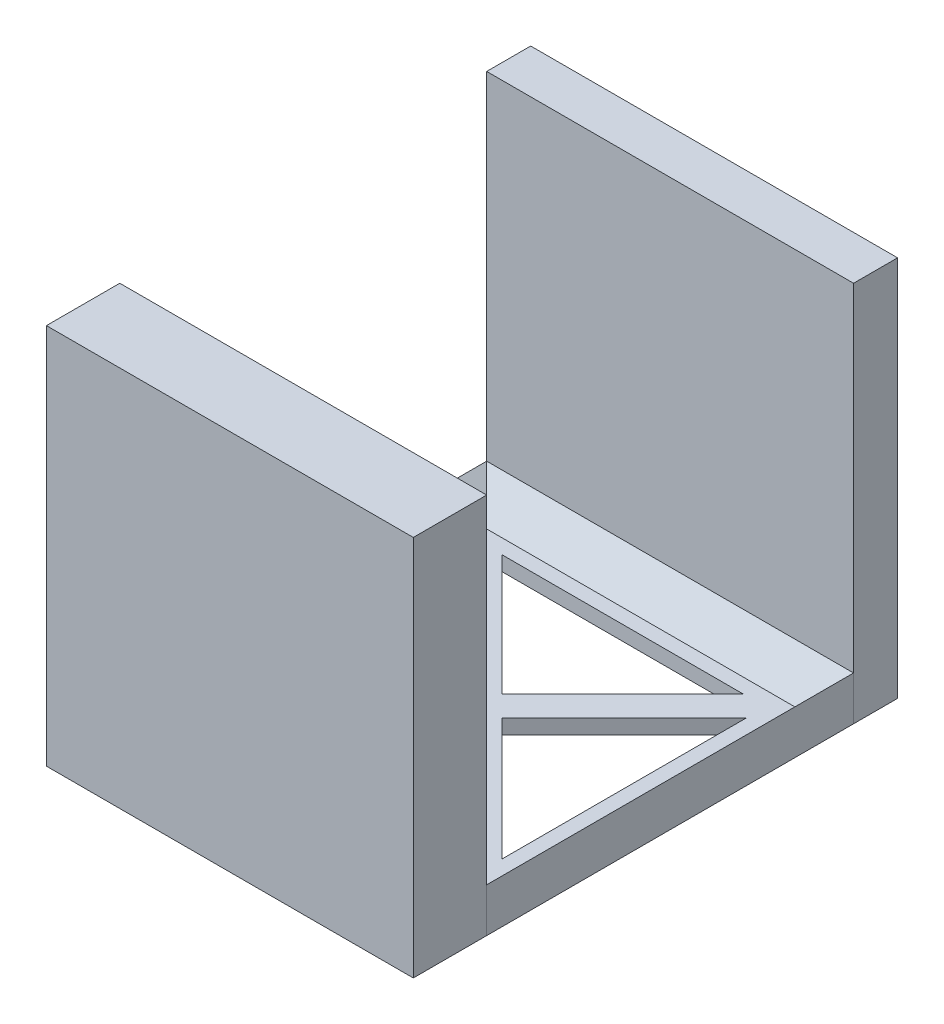
from build123d import *

# Parameters (mm, degrees)
SKIZZE1_W                         = 25
SKIZZE1_H                         = 25
AUFSATZ_LINEAR_AUSTRAGEN1_DEPTH   = 1
SKIZZE2_W                         = 25
SKIZZE2_H                         = 25
SKIZZE2_W_2                       = 21
SKIZZE2_H_2                       = 21
AUFSATZ_LINEAR_AUSTRAGEN2_DEPTH   = 2
FASE1_SIZE                        = 2
SKIZZE3_W                         = 25
SKIZZE3_H                         = 5
AUFSATZ_LINEAR_AUSTRAGEN3_DEPTH   = 26
SKIZZE3_H_2                       = 3
AUFSATZ_LINEAR_AUSTRAGEN3_2_DEPTH = 26
WANDUNG1_T                        = -1.5
SKIZZE4_R                         = 0.8
SCHNITT_LINEAR_AUSTRAGEN1_DEPTH   = 1.5


with BuildPart() as part:
    # Skizze1 → Aufsatz-Linear austragen1 (new body)
    with BuildSketch(Plane(origin=(0, 0, 0), x_dir=(1, 0, 0), z_dir=(0, 1, 0))):
        with Locations((70.01188303, 0.934256055)):
            Rectangle(SKIZZE1_W, SKIZZE1_H)
        Polygon((69.774043995, 2.230680518), (77.977619533, 10.434256055), (61.570468458, 10.434256055), align=None, mode=Mode.SUBTRACT)
        Polygon((60.51188303, -7.031480447), (68.359830433, 0.816466956), (60.51188303, 8.664414358), align=None, mode=Mode.SUBTRACT)
        Polygon((61.806046657, -8.565743945), (69.774043995, -0.597746607), (77.742041333, -8.565743945), align=None, mode=Mode.SUBTRACT)
        Polygon((71.188257558, 0.816466956), (79.51188303, -7.507158517), (79.51188303, 9.140092428), align=None, mode=Mode.SUBTRACT)
    extrude(amount=AUFSATZ_LINEAR_AUSTRAGEN1_DEPTH)

    # Skizze2 → Aufsatz-Linear austragen2 (add)
    with BuildSketch(Plane(origin=(0, 1, 0), x_dir=(1, 0, 0), z_dir=(0, 1, 0))):
        with Locations((70.01188303, 0.934256055)):
            Rectangle(SKIZZE2_W, SKIZZE2_H)
        with Locations((70.01188303, 0.934256055)):
            Rectangle(SKIZZE2_W_2, SKIZZE2_H_2, mode=Mode.SUBTRACT)
    extrude(amount=AUFSATZ_LINEAR_AUSTRAGEN2_DEPTH)

    # Fase1
    fase1_edges = [part.edges().sort_by_distance(p)[0] for p in [
        (70.01188303, 3, 9.565743945),
        (80.51188303, 3, -0.934256055),
        (59.51188303, 3, -0.934256055),
        (70.01188303, 3, -11.434256055),
    ]]
    chamfer(fase1_edges, length=FASE1_SIZE - 0.0001)  # a hair under: the kernel refuses the full size


with BuildPart() as body_2:
    # Skizze3 → Aufsatz-Linear austragen3 (new body)
    with BuildSketch(Plane(origin=(0, 0, 0), x_dir=(1, 0, 0), z_dir=(0, 1, 0))):
        with Locations((70.01188303, -14.065743945)):
            Rectangle(SKIZZE3_W, SKIZZE3_H)
    extrude(amount=AUFSATZ_LINEAR_AUSTRAGEN3_DEPTH)

    # Wandung1
    wandung1_openings = [body_2.faces().sort_by_distance(p)[0] for p in [
        (70.01188303, 0, 14.065743945),
    ]]
    offset(amount=WANDUNG1_T, openings=wandung1_openings, kind=Kind.INTERSECTION)

    # Skizze4 → Schnitt-Linear austragen1 (cut)
    with BuildSketch(Plane(origin=(0, 0, 11.565743945), x_dir=(-1, 0, 0), z_dir=(0, 0, -1))):
        with Locations((-62.51188303, 16)):
            Circle(SKIZZE4_R)
        with Locations((-67.51188303, 16)):
            Circle(SKIZZE4_R)
        with Locations((-72.51188303, 16)):
            Circle(SKIZZE4_R)
        with Locations((-77.51188303, 16)):
            Circle(SKIZZE4_R)
    extrude(amount=-SCHNITT_LINEAR_AUSTRAGEN1_DEPTH, mode=Mode.SUBTRACT)


with BuildPart() as body_3:
    # Skizze3 → Aufsatz-Linear austragen3 2 (new body)
    with BuildSketch(Plane(origin=(0, 0, 0), x_dir=(1, 0, 0), z_dir=(0, 1, 0))):
        with Locations((70.01188303, 14.934256055)):
            Rectangle(SKIZZE3_W, SKIZZE3_H_2)
    extrude(amount=AUFSATZ_LINEAR_AUSTRAGEN3_2_DEPTH)


solid = Compound([part.part, body_2.part, body_3.part])
